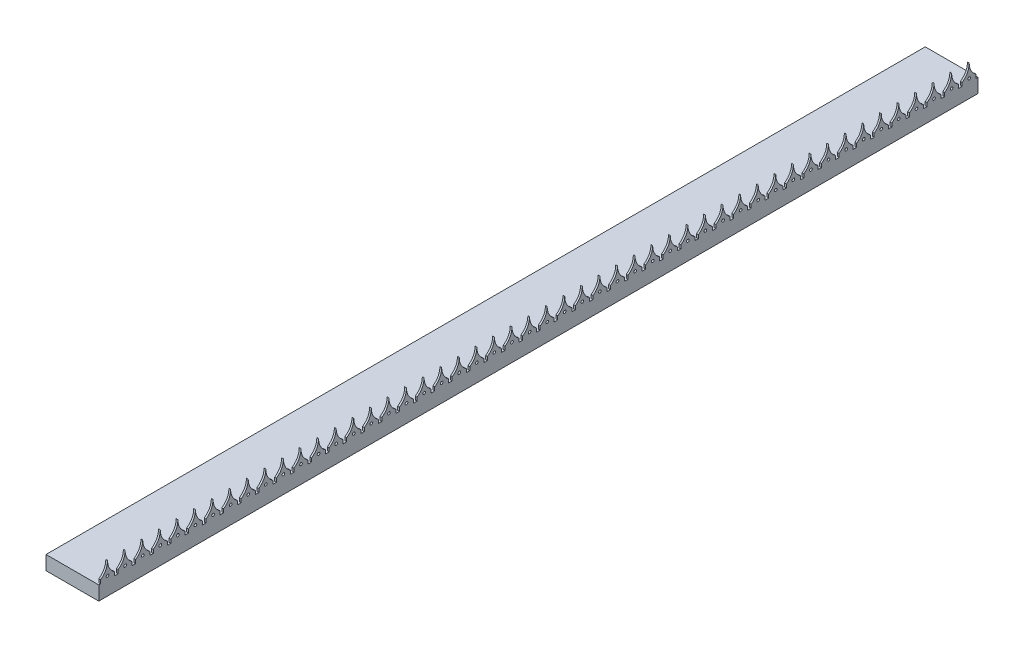
from build123d import *

# Parameters (mm, degrees)
SKETCH1_W           = 30
SKETCH1_H           = 8
BOSS_EXTRUDE1_DEPTH = 10
SKETCH2_R           = 0.75
BOSS_EXTRUDE2_DEPTH = 1
LPATTERN1_COUNT     = 50
LPATTERN1_PITCH     = 10


with BuildPart() as part:
    # Sketch1 → Boss-Extrude1 (new body)
    with BuildSketch(Plane.XY):
        Rectangle(SKETCH1_W, SKETCH1_H)
    boss_extrude1 = extrude(amount=BOSS_EXTRUDE1_DEPTH)

    # Sketch2 → Boss-Extrude2 (add)
    with BuildSketch(Plane(origin=(15, 0, 0), x_dir=(0, 0, -1), z_dir=(1, 0, 0))):
        with BuildLine():
            Line((-9, 6), (-9, 4))
            Line((-9, 4), (-1, 4))
            Line((-1, 4), (-1, 6))
            add(Edge.make_bspline(
                [(-1, 6), (-4.954171412, 8.792354792), (-5, 13.627807139)],
                knots=[0, 0, 0, 0.977085706, 0.977085706, 0.977085706], degree=2))
            add(Edge.make_bspline(
                [(-9, 6), (-5.045828588, 8.792354792), (-5, 13.627807139)],
                knots=[0, 0, 0, 0.977085706, 0.977085706, 0.977085706], degree=2))
        make_face()
        with Locations((-5, 6)):
            Circle(SKETCH2_R, mode=Mode.SUBTRACT)
    boss_extrude2 = extrude(amount=-BOSS_EXTRUDE2_DEPTH)

    # LPattern1: Boss-Extrude1, Boss-Extrude2 ×50
    with Locations(*[(0, 0, i * LPATTERN1_PITCH) for i in range(1, LPATTERN1_COUNT)]):
        add(boss_extrude1)
        add(boss_extrude2)


solid = part.part
